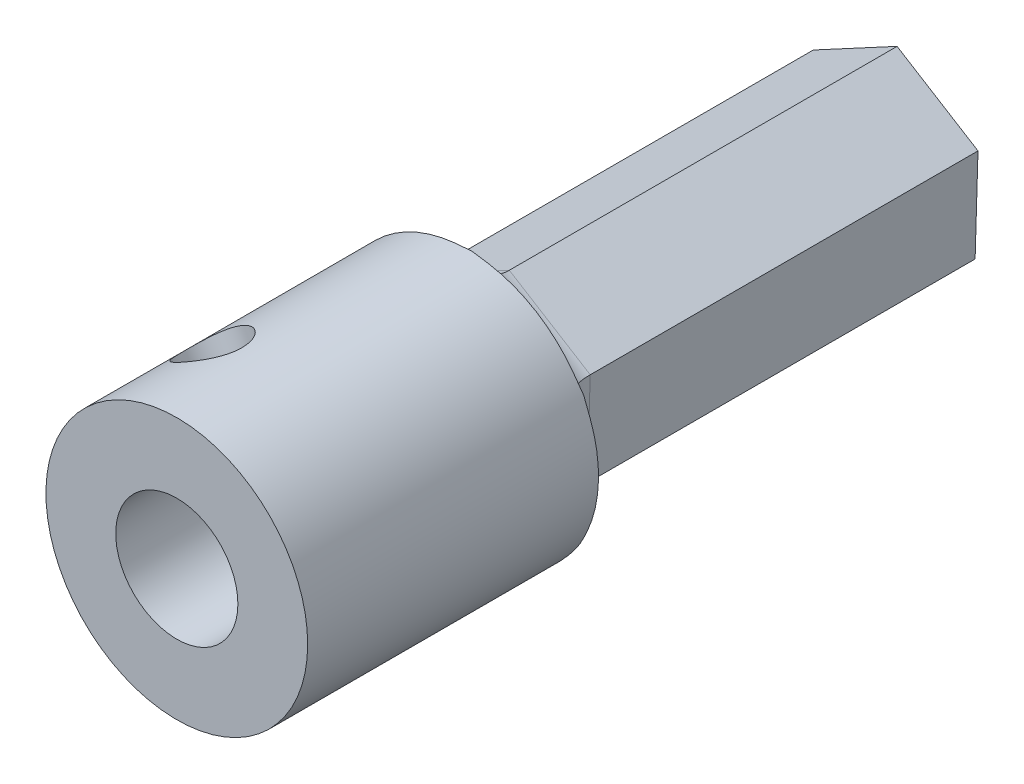
from build123d import *

# Parameters (mm, degrees)
BOSS_EXTRUDE1_DEPTH     = 22
SKETCH2_R               = 6.75
BOSS_EXTRUDE2_DEPTH     = 15
SKETCH3_R               = 3.15
CUT_EXTRUDE1_DEPTH      = 13
FILLET2_R               = 2
CUT_EXTRUDE2_DEPTH      = 15
CUT_EXTRUDE2_DEPTH_BACK = 15
SKETCH8_R               = 1.65
SKETCH9_R               = 1.65
CUT_EXTRUDE3_DEPTH      = 25


with BuildPart() as part:
    # Sketch1 → Boss-Extrude1 (new body)
    with BuildSketch(Plane.XY):
        Polygon((4.322551167, 2.323550029), (0.149022231, 4.905214135), (-4.173528936, 2.581664105), (-4.322551167, -2.323550029), (-0.149022231, -4.905214135), (4.173528936, -2.581664105), align=None)
    extrude(amount=BOSS_EXTRUDE1_DEPTH)

    # Sketch2 → Boss-Extrude2 (add)
    with BuildSketch(Plane.XY.offset(22)):
        Circle(SKETCH2_R)
    extrude(amount=BOSS_EXTRUDE2_DEPTH)

    # Sketch3 → Cut-Extrude1 (cut)
    with BuildSketch(Plane.XY.offset(37)):
        Circle(SKETCH3_R)
    extrude(amount=-CUT_EXTRUDE1_DEPTH, mode=Mode.SUBTRACT)

    # Fillet2
    # the kernel refuses this fillet: 2 mm, written as the material it adds along each edge
    with BuildSketch(Plane(origin=(-4.021697127, 7.579358284, 22), x_dir=(-0.9995388356967246, 0.03036636188344198, 0), z_dir=(-0.03036636188344198, -0.9995388356967246, 0))) as fillet2_piece_1_section:
        with BuildLine():
            CenterArc((FILLET2_R, FILLET2_R), FILLET2_R, 180, 90)
            Line((0, FILLET2_R), (0, 0))
            Line((0, 0), (FILLET2_R, 0))
        make_face()
    fillet2_piece_1 = extrude(amount=14.907477288, mode=Mode.PRIVATE)
    fillet2_piece_1 = split(fillet2_piece_1, bisect_by=Plane(origin=(-5.562210671, 1.835190238, 21.518286734), z_dir=(0.47347137703679, -0.8808092047242047, 0)), keep=Keep.TOP, mode=Mode.PRIVATE)
    fillet2_piece_1 = split(fillet2_piece_1, bisect_by=Plane(origin=(-5.663357367, -1.494153303, 21.518286734), z_dir=(0.5260674586599345, 0.8504428428407627, 0)), keep=Keep.TOP, mode=Mode.PRIVATE)
    add(fillet2_piece_1)
    with BuildSketch(Plane(origin=(-8.574765382, 0.306787264, 22), x_dir=(-0.5260674586599345, -0.8504428428407627, 0), z_dir=(0.8504428428407627, -0.5260674586599345, 0))) as fillet2_piece_2_section:
        with BuildLine():
            CenterArc((FILLET2_R, FILLET2_R), FILLET2_R, 180, 90)
            Line((0, FILLET2_R), (0, 0))
            Line((0, 0), (FILLET2_R, 0))
        make_face()
    fillet2_piece_2 = extrude(amount=14.907477288, mode=Mode.PRIVATE)
    fillet2_piece_2 = split(fillet2_piece_2, bisect_by=Plane(origin=(-4.370426703, -3.899420623, 21.518286734), z_dir=(0.9995388356967246, -0.03036636188344198, 0)), keep=Keep.TOP, mode=Mode.PRIVATE)
    fillet2_piece_2 = split(fillet2_piece_2, bisect_by=Plane(origin=(-1.537703966, -5.651688002, 21.518286734), z_dir=(-0.47347137703679004, 0.8808092047242047, 0)), keep=Keep.TOP, mode=Mode.PRIVATE)
    add(fillet2_piece_2)
    with BuildSketch(Plane(origin=(-4.553068255, -7.27257102, 22), x_dir=(0.4734713770367901, -0.8808092047242048, 0), z_dir=(0.8808092047242047, 0.47347137703679004, 0))) as fillet2_piece_3_section:
        with BuildLine():
            CenterArc((FILLET2_R, FILLET2_R), FILLET2_R, 180, 90)
            Line((0, FILLET2_R), (0, 0))
            Line((0, 0), (FILLET2_R, 0))
        make_face()
    fillet2_piece_3 = extrude(amount=14.907477288, mode=Mode.PRIVATE)
    fillet2_piece_3 = split(fillet2_piece_3, bisect_by=Plane(origin=(1.191783968, -5.734610861, 21.518286734), z_dir=(0.5260674586599345, 0.8504428428407627, 0)), keep=Keep.TOP, mode=Mode.PRIVATE)
    fillet2_piece_3 = split(fillet2_piece_3, bisect_by=Plane(origin=(4.125653401, -4.157534699, 21.518286734), z_dir=(-0.9995388356967246, 0.03036636188344197, 0)), keep=Keep.TOP, mode=Mode.PRIVATE)
    add(fillet2_piece_3)
    with BuildSketch(Plane(origin=(4.021697127, -7.579358284, 22), x_dir=(0.9995388356967246, -0.03036636188344197, 0), z_dir=(0.03036636188344197, 0.9995388356967246, 0))) as fillet2_piece_4_section:
        with BuildLine():
            CenterArc((FILLET2_R, FILLET2_R), FILLET2_R, 180, 90)
            Line((0, FILLET2_R), (0, 0))
            Line((0, 0), (FILLET2_R, 0))
        make_face()
    fillet2_piece_4 = extrude(amount=14.907477288, mode=Mode.PRIVATE)
    fillet2_piece_4 = split(fillet2_piece_4, bisect_by=Plane(origin=(5.663357367, 1.494153303, 21.518286734), z_dir=(-0.5260674586599344, -0.8504428428407627, 0)), keep=Keep.TOP, mode=Mode.PRIVATE)
    fillet2_piece_4 = split(fillet2_piece_4, bisect_by=Plane(origin=(5.562210671, -1.835190238, 21.518286734), z_dir=(-0.47347137703679004, 0.8808092047242047, 0)), keep=Keep.TOP, mode=Mode.PRIVATE)
    add(fillet2_piece_4)
    with BuildSketch(Plane(origin=(8.574765382, -0.306787264, 22), x_dir=(0.5260674586599344, 0.8504428428407628, 0), z_dir=(-0.8504428428407627, 0.5260674586599344, 0))) as fillet2_piece_5_section:
        with BuildLine():
            CenterArc((FILLET2_R, FILLET2_R), FILLET2_R, 180, 90)
            Line((0, FILLET2_R), (0, 0))
            Line((0, 0), (FILLET2_R, 0))
        make_face()
    fillet2_piece_5 = extrude(amount=14.907477288, mode=Mode.PRIVATE)
    fillet2_piece_5 = split(fillet2_piece_5, bisect_by=Plane(origin=(4.370426703, 3.899420623, 21.518286734), z_dir=(-0.9995388356967246, 0.03036636188344197, 0)), keep=Keep.TOP, mode=Mode.PRIVATE)
    fillet2_piece_5 = split(fillet2_piece_5, bisect_by=Plane(origin=(1.537703966, 5.651688002, 21.518286734), z_dir=(0.47347137703679, -0.8808092047242047, 0)), keep=Keep.TOP, mode=Mode.PRIVATE)
    add(fillet2_piece_5)
    with BuildSketch(Plane(origin=(4.553068255, 7.27257102, 22), x_dir=(-0.47347137703678993, 0.8808092047242047, 0), z_dir=(-0.8808092047242047, -0.47347137703679, 0))) as fillet2_piece_6_section:
        with BuildLine():
            CenterArc((FILLET2_R, FILLET2_R), FILLET2_R, 180, 90)
            Line((0, FILLET2_R), (0, 0))
            Line((0, 0), (FILLET2_R, 0))
        make_face()
    fillet2_piece_6 = extrude(amount=14.907477288, mode=Mode.PRIVATE)
    fillet2_piece_6 = split(fillet2_piece_6, bisect_by=Plane(origin=(-1.191783968, 5.734610861, 21.518286734), z_dir=(-0.5260674586599344, -0.8504428428407627, 0)), keep=Keep.TOP, mode=Mode.PRIVATE)
    fillet2_piece_6 = split(fillet2_piece_6, bisect_by=Plane(origin=(-4.125653401, 4.157534699, 21.518286734), z_dir=(0.9995388356967246, -0.03036636188344198, 0)), keep=Keep.TOP, mode=Mode.PRIVATE)
    add(fillet2_piece_6)
    with BuildSketch(Plane(origin=(4.553068255, 7.27257102, 22), x_dir=(-0.47347137703678993, 0.8808092047242047, 0), z_dir=(-0.8808092047242047, -0.47347137703679, 0))) as fillet2_piece_7a_section:
        with BuildLine():
            CenterArc((FILLET2_R, FILLET2_R), FILLET2_R, 180, 90)
            Line((0, FILLET2_R), (0, 0))
            Line((0, 0), (FILLET2_R, 0))
        make_face()
    fillet2_piece_7a = extrude(amount=14.907477288, mode=Mode.PRIVATE)
    fillet2_piece_7a = fillet2_piece_7a & Plane(origin=(0, 0, 21.52699727), x_dir=(1, 0, 0), z_dir=(0, 0, -1)) * Cylinder(6.75, 38, mode=Mode.PRIVATE)
    fillet2_piece_7a = split(fillet2_piece_7a, bisect_by=Plane(origin=(-4.178945421, 2.403375135, 21.52699727), z_dir=(-0.9995388356967246, 0.03036636188344198, 0)), keep=Keep.TOP, mode=Mode.PRIVATE)
    with BuildSketch(Plane(origin=(-4.021697127, 7.579358284, 22), x_dir=(-0.9995388356967246, 0.03036636188344198, 0), z_dir=(-0.03036636188344198, -0.9995388356967246, 0))) as fillet2_piece_7b_section:
        with BuildLine():
            CenterArc((FILLET2_R, FILLET2_R), FILLET2_R, 180, 90)
            Line((0, FILLET2_R), (0, 0))
            Line((0, 0), (FILLET2_R, 0))
        make_face()
    fillet2_piece_7b = extrude(amount=14.907477288, mode=Mode.PRIVATE)
    fillet2_piece_7b = fillet2_piece_7b & Plane(origin=(0, 0, 21.526998099), x_dir=(1, 0, 0), z_dir=(0, 0, -1)) * Cylinder(6.75, 38, mode=Mode.PRIVATE)
    fillet2_piece_7b = split(fillet2_piece_7b, bisect_by=Plane(origin=(-4.016417327, 2.666118093, 21.526998099), z_dir=(-0.47347137703679, 0.8808092047242047, 0)), keep=Keep.TOP, mode=Mode.PRIVATE)
    fillet2_piece_7 = fillet2_piece_7a & fillet2_piece_7b
    add(fillet2_piece_7)
    with BuildSketch(Plane(origin=(-4.021697127, 7.579358284, 22), x_dir=(-0.9995388356967246, 0.03036636188344198, 0), z_dir=(-0.03036636188344198, -0.9995388356967246, 0))) as fillet2_piece_8a_section:
        with BuildLine():
            CenterArc((FILLET2_R, FILLET2_R), FILLET2_R, 180, 90)
            Line((0, FILLET2_R), (0, 0))
            Line((0, 0), (FILLET2_R, 0))
        make_face()
    fillet2_piece_8a = extrude(amount=14.907477288, mode=Mode.PRIVATE)
    fillet2_piece_8a = fillet2_piece_8a & Plane(origin=(0, 0, 21.52699727), x_dir=(1, 0, 0), z_dir=(0, 0, -1)) * Cylinder(6.75, 38, mode=Mode.PRIVATE)
    fillet2_piece_8a = split(fillet2_piece_8a, bisect_by=Plane(origin=(-4.170856632, -2.417385329, 21.52699727), z_dir=(-0.5260674586599345, -0.8504428428407627, 0)), keep=Keep.TOP, mode=Mode.PRIVATE)
    with BuildSketch(Plane(origin=(-8.574765382, 0.306787264, 22), x_dir=(-0.5260674586599345, -0.8504428428407627, 0), z_dir=(0.8504428428407627, -0.5260674586599345, 0))) as fillet2_piece_8b_section:
        with BuildLine():
            CenterArc((FILLET2_R, FILLET2_R), FILLET2_R, 180, 90)
            Line((0, FILLET2_R), (0, 0))
            Line((0, 0), (FILLET2_R, 0))
        make_face()
    fillet2_piece_8b = extrude(amount=14.907477288, mode=Mode.PRIVATE)
    fillet2_piece_8b = fillet2_piece_8b & Plane(origin=(0, 0, 21.526998099), x_dir=(1, 0, 0), z_dir=(0, 0, -1)) * Cylinder(6.75, 38, mode=Mode.PRIVATE)
    fillet2_piece_8b = split(fillet2_piece_8b, bisect_by=Plane(origin=(-4.317134662, -2.145260391, 21.526998099), z_dir=(-0.9995388356967246, 0.03036636188344198, 0)), keep=Keep.TOP, mode=Mode.PRIVATE)
    fillet2_piece_8 = fillet2_piece_8a & fillet2_piece_8b
    add(fillet2_piece_8)
    with BuildSketch(Plane(origin=(-8.574765382, 0.306787264, 22), x_dir=(-0.5260674586599345, -0.8504428428407627, 0), z_dir=(0.8504428428407627, -0.5260674586599345, 0))) as fillet2_piece_9a_section:
        with BuildLine():
            CenterArc((FILLET2_R, FILLET2_R), FILLET2_R, 180, 90)
            Line((0, FILLET2_R), (0, 0))
            Line((0, 0), (FILLET2_R, 0))
        make_face()
    fillet2_piece_9a = extrude(amount=14.907477288, mode=Mode.PRIVATE)
    fillet2_piece_9a = fillet2_piece_9a & Plane(origin=(0, 0, 21.52699727), x_dir=(1, 0, 0), z_dir=(0, 0, -1)) * Cylinder(6.75, 38, mode=Mode.PRIVATE)
    fillet2_piece_9a = split(fillet2_piece_9a, bisect_by=Plane(origin=(0.008088789, -4.820760463, 21.52699727), z_dir=(0.47347137703679004, -0.8808092047242047, 0)), keep=Keep.TOP, mode=Mode.PRIVATE)
    with BuildSketch(Plane(origin=(-4.553068255, -7.27257102, 22), x_dir=(0.4734713770367901, -0.8808092047242048, 0), z_dir=(0.8808092047242047, 0.47347137703679004, 0))) as fillet2_piece_9b_section:
        with BuildLine():
            CenterArc((FILLET2_R, FILLET2_R), FILLET2_R, 180, 90)
            Line((0, FILLET2_R), (0, 0))
            Line((0, 0), (FILLET2_R, 0))
        make_face()
    fillet2_piece_9b = extrude(amount=14.907477288, mode=Mode.PRIVATE)
    fillet2_piece_9b = fillet2_piece_9b & Plane(origin=(0, 0, 21.526998099), x_dir=(1, 0, 0), z_dir=(0, 0, -1)) * Cylinder(6.75, 38, mode=Mode.PRIVATE)
    fillet2_piece_9b = split(fillet2_piece_9b, bisect_by=Plane(origin=(-0.300717335, -4.811378484, 21.526998099), z_dir=(-0.5260674586599345, -0.8504428428407627, 0)), keep=Keep.TOP, mode=Mode.PRIVATE)
    fillet2_piece_9 = fillet2_piece_9a & fillet2_piece_9b
    add(fillet2_piece_9)
    with BuildSketch(Plane(origin=(-4.553068255, -7.27257102, 22), x_dir=(0.4734713770367901, -0.8808092047242048, 0), z_dir=(0.8808092047242047, 0.47347137703679004, 0))) as fillet2_piece_10a_section:
        with BuildLine():
            CenterArc((FILLET2_R, FILLET2_R), FILLET2_R, 180, 90)
            Line((0, FILLET2_R), (0, 0))
            Line((0, 0), (FILLET2_R, 0))
        make_face()
    fillet2_piece_10a = extrude(amount=14.907477288, mode=Mode.PRIVATE)
    fillet2_piece_10a = fillet2_piece_10a & Plane(origin=(0, 0, 21.52699727), x_dir=(1, 0, 0), z_dir=(0, 0, -1)) * Cylinder(6.75, 38, mode=Mode.PRIVATE)
    fillet2_piece_10a = split(fillet2_piece_10a, bisect_by=Plane(origin=(4.178945421, -2.403375135, 21.52699727), z_dir=(0.9995388356967246, -0.03036636188344197, 0)), keep=Keep.TOP, mode=Mode.PRIVATE)
    with BuildSketch(Plane(origin=(4.021697127, -7.579358284, 22), x_dir=(0.9995388356967246, -0.03036636188344197, 0), z_dir=(0.03036636188344197, 0.9995388356967246, 0))) as fillet2_piece_10b_section:
        with BuildLine():
            CenterArc((FILLET2_R, FILLET2_R), FILLET2_R, 180, 90)
            Line((0, FILLET2_R), (0, 0))
            Line((0, 0), (FILLET2_R, 0))
        make_face()
    fillet2_piece_10b = extrude(amount=14.907477288, mode=Mode.PRIVATE)
    fillet2_piece_10b = fillet2_piece_10b & Plane(origin=(0, 0, 21.526998099), x_dir=(1, 0, 0), z_dir=(0, 0, -1)) * Cylinder(6.75, 38, mode=Mode.PRIVATE)
    fillet2_piece_10b = split(fillet2_piece_10b, bisect_by=Plane(origin=(4.016417327, -2.666118093, 21.526998099), z_dir=(0.47347137703679004, -0.8808092047242047, 0)), keep=Keep.TOP, mode=Mode.PRIVATE)
    fillet2_piece_10 = fillet2_piece_10a & fillet2_piece_10b
    add(fillet2_piece_10)
    with BuildSketch(Plane(origin=(8.574765382, -0.306787264, 22), x_dir=(0.5260674586599344, 0.8504428428407628, 0), z_dir=(-0.8504428428407627, 0.5260674586599344, 0))) as fillet2_piece_11a_section:
        with BuildLine():
            CenterArc((FILLET2_R, FILLET2_R), FILLET2_R, 180, 90)
            Line((0, FILLET2_R), (0, 0))
            Line((0, 0), (FILLET2_R, 0))
        make_face()
    fillet2_piece_11a = extrude(amount=14.907477288, mode=Mode.PRIVATE)
    fillet2_piece_11a = fillet2_piece_11a & Plane(origin=(0, 0, 21.526998099), x_dir=(1, 0, 0), z_dir=(0, 0, -1)) * Cylinder(6.75, 38, mode=Mode.PRIVATE)
    fillet2_piece_11a = split(fillet2_piece_11a, bisect_by=Plane(origin=(4.317134662, 2.145260391, 21.526998099), z_dir=(0.9995388356967246, -0.03036636188344197, 0)), keep=Keep.TOP, mode=Mode.PRIVATE)
    with BuildSketch(Plane(origin=(4.021697127, -7.579358284, 22), x_dir=(0.9995388356967246, -0.03036636188344197, 0), z_dir=(0.03036636188344197, 0.9995388356967246, 0))) as fillet2_piece_11b_section:
        with BuildLine():
            CenterArc((FILLET2_R, FILLET2_R), FILLET2_R, 180, 90)
            Line((0, FILLET2_R), (0, 0))
            Line((0, 0), (FILLET2_R, 0))
        make_face()
    fillet2_piece_11b = extrude(amount=14.907477288, mode=Mode.PRIVATE)
    fillet2_piece_11b = fillet2_piece_11b & Plane(origin=(0, 0, 21.52699727), x_dir=(1, 0, 0), z_dir=(0, 0, -1)) * Cylinder(6.75, 38, mode=Mode.PRIVATE)
    fillet2_piece_11b = split(fillet2_piece_11b, bisect_by=Plane(origin=(4.170856632, 2.417385329, 21.52699727), z_dir=(0.5260674586599344, 0.8504428428407627, 0)), keep=Keep.TOP, mode=Mode.PRIVATE)
    fillet2_piece_11 = fillet2_piece_11a & fillet2_piece_11b
    add(fillet2_piece_11)
    with BuildSketch(Plane(origin=(8.574765382, -0.306787264, 22), x_dir=(0.5260674586599344, 0.8504428428407628, 0), z_dir=(-0.8504428428407627, 0.5260674586599344, 0))) as fillet2_piece_12a_section:
        with BuildLine():
            CenterArc((FILLET2_R, FILLET2_R), FILLET2_R, 180, 90)
            Line((0, FILLET2_R), (0, 0))
            Line((0, 0), (FILLET2_R, 0))
        make_face()
    fillet2_piece_12a = extrude(amount=14.907477288, mode=Mode.PRIVATE)
    fillet2_piece_12a = fillet2_piece_12a & Plane(origin=(0, 0, 21.52699727), x_dir=(1, 0, 0), z_dir=(0, 0, -1)) * Cylinder(6.75, 38, mode=Mode.PRIVATE)
    fillet2_piece_12a = split(fillet2_piece_12a, bisect_by=Plane(origin=(-0.008088789, 4.820760463, 21.52699727), z_dir=(-0.47347137703679, 0.8808092047242047, 0)), keep=Keep.TOP, mode=Mode.PRIVATE)
    with BuildSketch(Plane(origin=(4.553068255, 7.27257102, 22), x_dir=(-0.47347137703678993, 0.8808092047242047, 0), z_dir=(-0.8808092047242047, -0.47347137703679, 0))) as fillet2_piece_12b_section:
        with BuildLine():
            CenterArc((FILLET2_R, FILLET2_R), FILLET2_R, 180, 90)
            Line((0, FILLET2_R), (0, 0))
            Line((0, 0), (FILLET2_R, 0))
        make_face()
    fillet2_piece_12b = extrude(amount=14.907477288, mode=Mode.PRIVATE)
    fillet2_piece_12b = fillet2_piece_12b & Plane(origin=(0, 0, 21.526998099), x_dir=(1, 0, 0), z_dir=(0, 0, -1)) * Cylinder(6.75, 38, mode=Mode.PRIVATE)
    fillet2_piece_12b = split(fillet2_piece_12b, bisect_by=Plane(origin=(0.300717335, 4.811378484, 21.526998099), z_dir=(0.5260674586599344, 0.8504428428407627, 0)), keep=Keep.TOP, mode=Mode.PRIVATE)
    fillet2_piece_12 = fillet2_piece_12a & fillet2_piece_12b
    add(fillet2_piece_12)

    # Sketch8 → Cut-Extrude2 (cut, two sides: drawn at the far end of the back side and taken through both)
    with BuildSketch(Plane(origin=(2.012253352, -3.74343912, 0), x_dir=(-0.8808092047242045, -0.4734713770367903, 0), z_dir=(0.4734713770367903, -0.8808092047242045, 0)).offset(-CUT_EXTRUDE2_DEPTH_BACK)):
        with Locations((0, -32)):
            Circle(SKETCH8_R)
    extrude(amount=CUT_EXTRUDE2_DEPTH + CUT_EXTRUDE2_DEPTH_BACK, mode=Mode.SUBTRACT)

    # Sketch9 → Cut-Extrude3 (cut)
    with BuildSketch(Plane(origin=(0, 0, 0), x_dir=(-1, 0, 0), z_dir=(0, 0, -1))):
        Circle(SKETCH9_R)
    extrude(amount=-CUT_EXTRUDE3_DEPTH, mode=Mode.SUBTRACT)


solid = part.part
